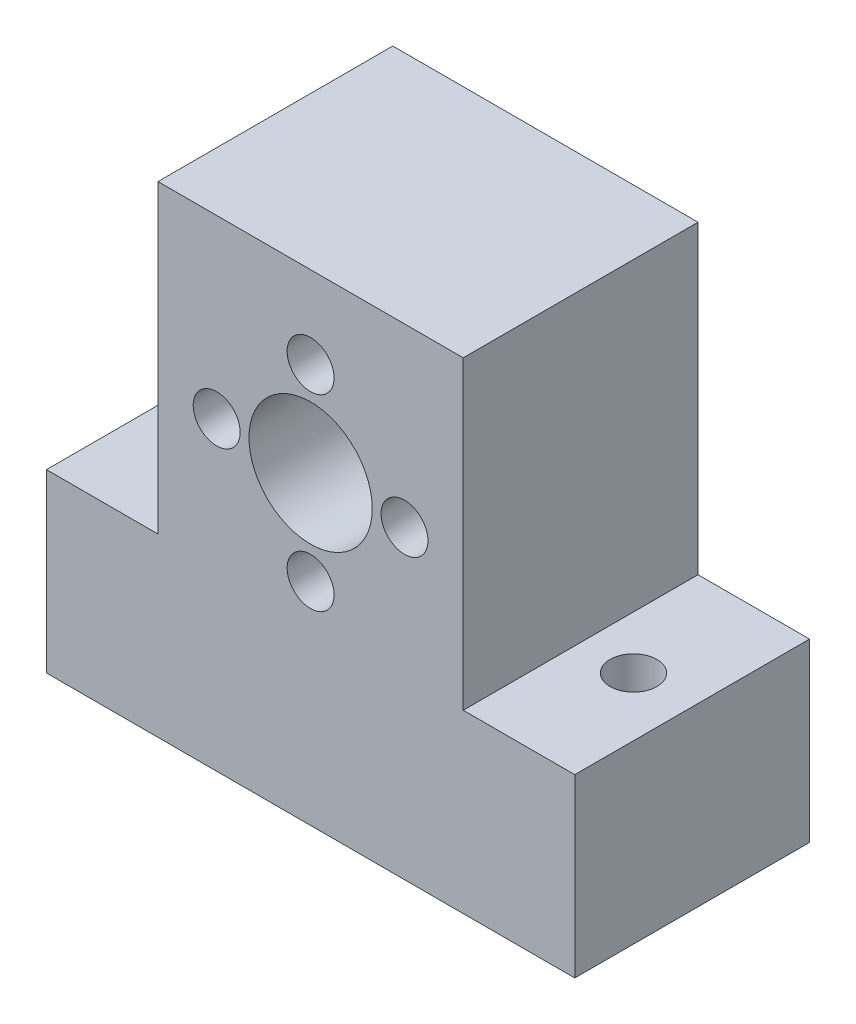
from build123d import *

# Parameters (mm, degrees)
SKETCH1_W           = 45
SKETCH1_H           = 41
SKETCH1_R           = 5.25
SKETCH1_R_2         = 2
BOSS_EXTRUDE1_DEPTH = 20
SKETCH2_R           = 2
CUT_EXTRUDE1_DEPTH  = 51.865017448
SKETCH3_W           = 9.5
SKETCH3_H           = 26
CUT_EXTRUDE2_DEPTH  = 40.777506206


with BuildPart() as part:
    # Sketch1 → Boss-Extrude1 (new body)
    with BuildSketch(Plane.XY):
        with Locations((0, -5.5)):
            Rectangle(SKETCH1_W, SKETCH1_H)
        Circle(SKETCH1_R, mode=Mode.SUBTRACT)
        with Locations((0, 8)):
            Circle(SKETCH1_R_2, mode=Mode.SUBTRACT)
        with Locations((8, 0)):
            Circle(SKETCH1_R_2, mode=Mode.SUBTRACT)
        with Locations((0, -8)):
            Circle(SKETCH1_R_2, mode=Mode.SUBTRACT)
        with Locations((-8, 0)):
            Circle(SKETCH1_R_2, mode=Mode.SUBTRACT)
    extrude(amount=BOSS_EXTRUDE1_DEPTH)

    # Sketch2 → Cut-Extrude1 (cut, through all)
    with BuildSketch(Plane(origin=(0, 15, 0), x_dir=(1, 0, 0), z_dir=(0, 1, 0))):
        with Locations((-17.5, -10)):
            Circle(SKETCH2_R)
        with Locations((17.5, -10)):
            Circle(SKETCH2_R)
    extrude(amount=-CUT_EXTRUDE1_DEPTH, mode=Mode.SUBTRACT)

    # Sketch3 → Cut-Extrude2 (cut, through all)
    with BuildSketch(Plane(origin=(0, 0, 0), x_dir=(-1, 0, 0), z_dir=(0, 0, -1))):
        with Locations((-17.75, 2)):
            Rectangle(SKETCH3_W, SKETCH3_H)
        with Locations((17.75, 2)):
            Rectangle(SKETCH3_W, SKETCH3_H)
    extrude(amount=-CUT_EXTRUDE2_DEPTH, mode=Mode.SUBTRACT)


solid = part.part
